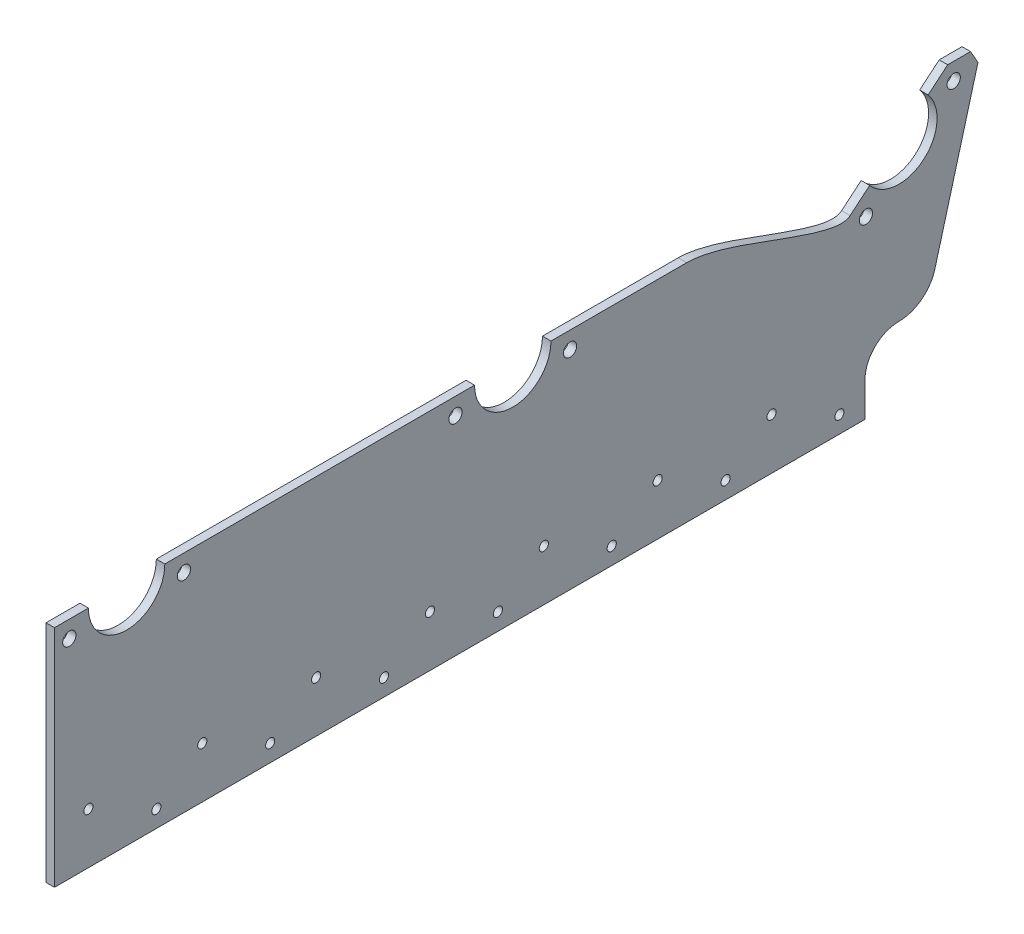
from build123d import *

# Parameters (mm, degrees)
BOSS_EXTRUDE1_DEPTH              = 3.175
F_10_CLEARANCE_HOLE1_D           = 4.9784
CHAMFER1_SIZE                    = 5.08
CHAMFER1_SIZE2                   = 4.134495326
F_1_8_0_135_DIAMETER_HOLE1_D     = 3.429
F_1_8_0_135_DIAMETER_HOLE1_DEPTH = 16.51
F_1_8_0_135_DIAMETER_HOLE1_TIP   = 1.030175531


with BuildPart() as part:
    # Sketch1 → Boss-Extrude1 (new body)
    with BuildSketch(Plane(origin=(0, 0, 0), x_dir=(0, 0, -1), z_dir=(1, 0, 0))):
        with BuildLine():
            Line((-12.7, -12.7), (-315.9125, -12.7))
            Line((-315.9125, -12.7), (-315.9125, 71.4375))
            Line((-315.9125, 71.4375), (-303.2125, 71.4375))
            ThreePointArc((-303.2125, 71.4375), (-288.925, 57.15), (-274.6375, 71.4375))
            Line((-274.6375, 71.4375), (-158.75, 71.4375))
            ThreePointArc((-158.75, 71.4375), (-144.4625, 57.15), (-130.175, 71.4375))
            Line((-130.175, 71.4375), (-79.375, 71.4375))
            add(Edge.make_bspline(
                [(-18.243165022, 56.129666959), (-24.729007974, 50.68739853), (-62.441666667, 71.4375), (-79.375, 71.4375)],
                knots=[0, 0, 0, 0, 1, 1, 1, 1], degree=3))
            Line((-18.243165022, 56.129666959), (-10.944859981, 62.253672027))
            ThreePointArc((-10.944859981, 62.253672027), (9.183827973, 60.492640019), (10.944859981, 80.621327973))
            Line((10.944859981, 80.621327973), (18.243165022, 86.745333041))
            Line((18.243165022, 86.745333041), (30.943165022, 86.745333041))
            Line((30.943165022, 86.745333041), (13.473517024, 22.978761859))
            ThreePointArc((13.473517024, 22.978761859), (8.473319986, 15.563076555), (0, 12.7))
            ThreePointArc((0, 12.7), (-8.980256121, 8.980256121), (-12.7, 0))
            Line((-12.7, 0), (-12.7, -12.7))
        make_face()
    extrude(amount=BOSS_EXTRUDE1_DEPTH)

    # #10 Clearance Hole1 (through all)
    with Locations(Plane(origin=(3.175, 0, 0), x_dir=(0, 0, -1), z_dir=(1, 0, 0))):
        with Locations((-310.35625, 65.0875), (-267.49375, 65.0875), (-165.89375, 65.0875), (-123.03125, 65.0875), (-12.33558865, 52.797375826), (20.498991293, 80.348859746)):
            Hole(F_10_CLEARANCE_HOLE1_D / 2)

    # Chamfer1
    chamfer1_edges = [part.edges().sort_by_distance(p)[0] for p in [
        (1.5875, 86.745333041, -30.943165022),
    ]]
    chamfer1_side = [part.faces().sort_by_distance(p)[0] for p in [
        (1.5875, 54.86204745, -22.208341023),
    ]]
    chamfer(chamfer1_edges, length=CHAMFER1_SIZE, length2=CHAMFER1_SIZE2, reference=chamfer1_side[0])

    # 1/8 (0.135) Diameter Hole1
    with Locations(Plane(origin=(3.175, 0, 0), x_dir=(0, 0, -1), z_dir=(1, 0, 0))):
        with Locations((-22.2504, -6.35), (-47.6504, 6.35), (-64.844083333, -6.35), (-90.244083333, 6.35), (-107.437766667, -6.35), (-132.837766667, 6.35), (-150.03145, -6.35), (-175.43145, 6.35), (-192.625133333, -6.35), (-218.025133333, 6.35), (-235.218816667, -6.35), (-260.618816667, 6.35), (-277.8125, -6.35), (-303.2125, 6.35)):
            Hole(F_1_8_0_135_DIAMETER_HOLE1_D / 2, depth=F_1_8_0_135_DIAMETER_HOLE1_DEPTH)
            with Locations((0, 0, -(F_1_8_0_135_DIAMETER_HOLE1_DEPTH + F_1_8_0_135_DIAMETER_HOLE1_TIP / 2))):  # 118° drill point
                Cone(0, F_1_8_0_135_DIAMETER_HOLE1_D / 2, F_1_8_0_135_DIAMETER_HOLE1_TIP, mode=Mode.SUBTRACT)


solid = part.part
